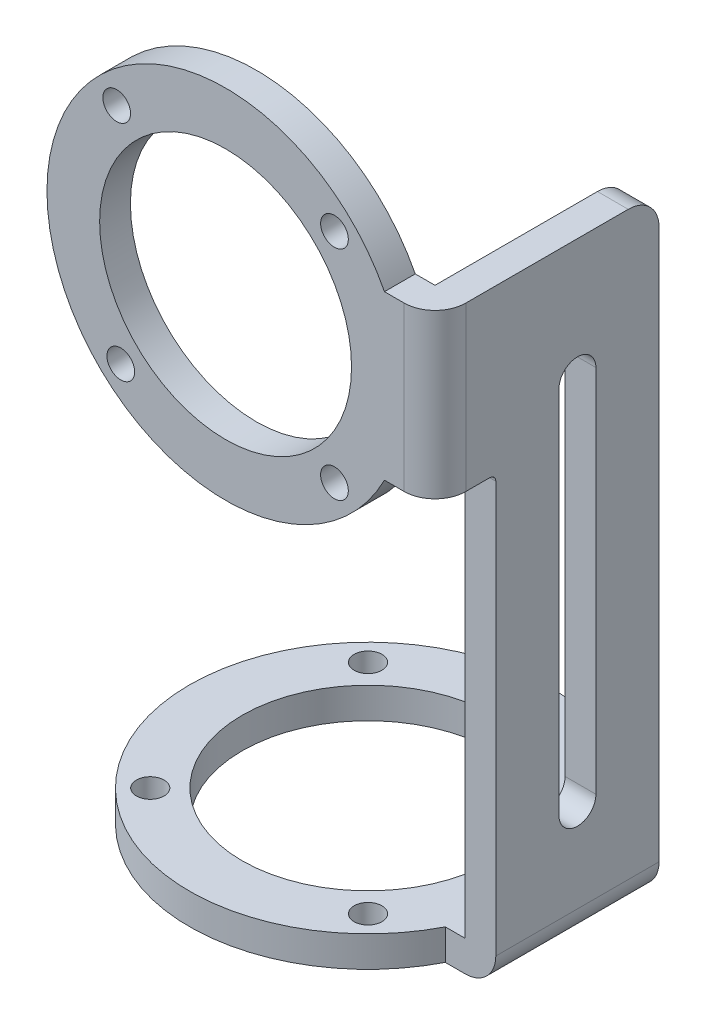
from build123d import *

# Parameters (mm, degrees)
SKETCH1_R           = 20.45
BOSS_EXTRUDE2_DEPTH = 5
BOSS_EXTRUDE3_DEPTH = 5
SKETCH14_R          = 20.45
BOSS_EXTRUDE6_DEPTH = 5
CUT_EXTRUDE2_DEPTH  = 5
BOSS_EXTRUDE7_DEPTH = 26.5
BOSS_EXTRUDE8_DEPTH = 26.5
CUT_EXTRUDE3_DEPTH  = 26.5
SKETCH24_R          = 2.25
CUT_EXTRUDE5_DEPTH  = 10
SKETCH25_R          = 2.25
CUT_EXTRUDE6_DEPTH  = 10


with BuildPart() as part:
    # Sketch1 → Boss-Extrude2 (new body)
    with BuildSketch(Plane.XY):
        with BuildLine():
            Line((29, 13.25), (25.796075283, 13.25))
            ThreePointArc((25.796075283, 13.25), (-29, 0), (25.796075283, -13.25))
            Line((25.796075283, -13.25), (29, -13.25))
            Line((29, -13.25), (29, 13.25))
        make_face()
        Circle(SKETCH1_R, mode=Mode.SUBTRACT)
    extrude(amount=BOSS_EXTRUDE2_DEPTH)



with BuildPart() as body_2:
    # Sketch2 → Boss-Extrude3 (new body)
    with BuildSketch(Plane(origin=(29, 0, 0), x_dir=(0, 0, -1), z_dir=(1, 0, 0))):
        with BuildLine():
            Line((0, 13.25), (26.375, 13.25))
            ThreePointArc((26.375, 13.25), (29.910533906, 11.785533906), (31.375, 8.25))
            Line((31.375, 8.25), (31.375, -81))
            Line((31.375, -81), (0, -81))
            Line((0, -81), (0, -13.25))
            Line((0, -13.25), (0, 13.25))
        make_face()
    extrude(amount=BOSS_EXTRUDE3_DEPTH)

    # Sketch17 → Cut-Extrude2 (cut)
    with BuildSketch(Plane(origin=(34, 0, 0), x_dir=(0, 0, -1), z_dir=(1, 0, 0))):
        with BuildLine():
            Line((0, -13.25), (3.875, -13.25))
            ThreePointArc((3.875, -13.25), (4.582106781, -13.542893219), (4.875, -14.25))
            Line((4.875, -14.25), (4.875, -81))
            Line((4.875, -81), (0, -81))
            Line((0, -81), (0, -13.25))
        make_face()
    extrude(amount=-CUT_EXTRUDE2_DEPTH, mode=Mode.SUBTRACT)


with BuildPart() as body_3:
    # Sketch14 → Boss-Extrude6 (new body)
    with BuildSketch(Plane.XZ.offset(81)):
        with BuildLine():
            ThreePointArc((25.796075283, -4.875), (-29, -18.125), (25.796075283, -31.375))
            Line((25.796075283, -31.375), (29, -31.375))
            Line((29, -31.375), (29, -4.875))
            Line((29, -4.875), (25.796075283, -4.875))
        make_face()
        with Locations((0, -18.125)):
            Circle(SKETCH14_R, mode=Mode.SUBTRACT)
    extrude(amount=BOSS_EXTRUDE6_DEPTH)


with BuildPart() as part_1:
    add(part.part)

    add(body_2.part)  # Boss-Extrude7 merges body 2
    # Sketch21 → Boss-Extrude7 (add)
    with BuildSketch(Plane(origin=(0, 13.25, 0), x_dir=(1, 0, 0), z_dir=(0, 1, 0))):
        with BuildLine():
            Line((34, 0), (29, 0))
            Line((29, 0), (29, -5))
            ThreePointArc((29, -5), (32.535533906, -3.535533906), (34, 0))
        make_face()
    extrude(amount=-BOSS_EXTRUDE7_DEPTH)


    add(body_3.part)  # Boss-Extrude8 merges body 3
    # Sketch22 → Boss-Extrude8 (add)
    with BuildSketch(Plane.XY.offset(-4.875)):
        with BuildLine():
            Line((34, -81), (29, -81))
            Line((29, -81), (29, -86))
            ThreePointArc((29, -86), (32.535533906, -84.535533906), (34, -81))
        make_face()
    extrude(amount=-BOSS_EXTRUDE8_DEPTH)

    # Sketch23 → Cut-Extrude3 (cut)
    with BuildSketch(Plane(origin=(34, 0, 0), x_dir=(0, 0, -1), z_dir=(1, 0, 0))):
        with BuildLine():
            Line((15.125, -6.375), (15.125, -66.375))
            ThreePointArc((15.125, -66.375), (18.125, -69.375), (21.125, -66.375))
            Line((21.125, -66.375), (21.125, -6.375))
            ThreePointArc((21.125, -6.375), (18.125, -3.375), (15.125, -6.375))
        make_face()
    extrude(amount=-CUT_EXTRUDE3_DEPTH, mode=Mode.SUBTRACT)

    # Sketch24 → Cut-Extrude5 (cut)
    with BuildSketch(Plane.XY.offset(5)):
        with Locations((17.67766953, 17.67766953)):
            Circle(SKETCH24_R)
        with Locations((17.67766953, -17.67766953)):
            Circle(SKETCH24_R)
        with Locations((-17.67766953, 17.67766953)):
            Circle(SKETCH24_R)
        with Locations((-17.01531967, -18.316083002)):
            Circle(SKETCH24_R)
    extrude(amount=-CUT_EXTRUDE5_DEPTH, mode=Mode.SUBTRACT)

    # Sketch25 → Cut-Extrude6 (cut)
    with BuildSketch(Plane.XZ.offset(86)):
        with Locations((-17.67766953, -0.44733047)):
            Circle(SKETCH25_R)
        with Locations((17.67766953, -0.44733047)):
            Circle(SKETCH25_R)
        with Locations((17.67766953, -35.80266953)):
            Circle(SKETCH25_R)
        with Locations((-17.67766953, -35.80266953)):
            Circle(SKETCH25_R)
    extrude(amount=-CUT_EXTRUDE6_DEPTH, mode=Mode.SUBTRACT)


solid = part_1.part
